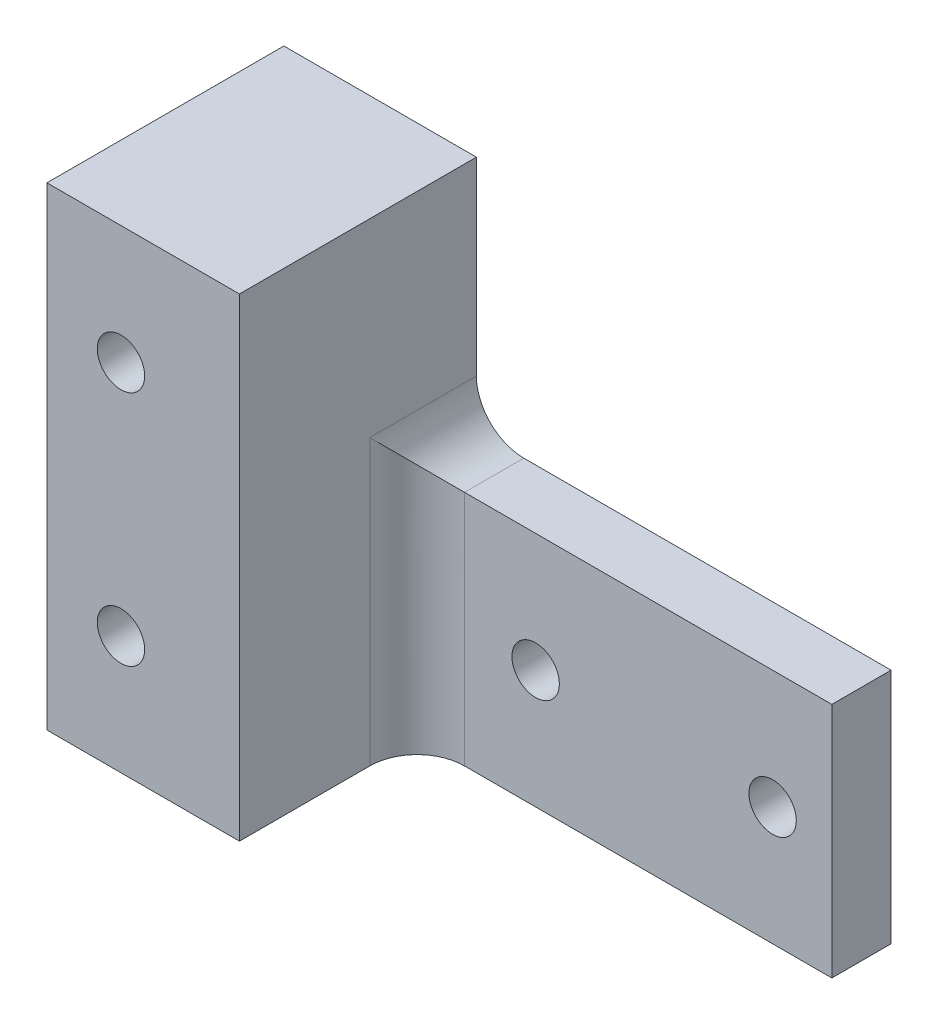
from build123d import *

# Parameters (mm, degrees)
BOSS_EXTRUDE1_DEPTH = 25.4
SKETCH2_R           = 2.54
CUT_EXTRUDE1_DEPTH  = 91.02678768
SKETCH3_W           = 4.7625
SKETCH3_H           = 50.8
CUT_EXTRUDE2_DEPTH  = 91.02678768
SKETCH4_W           = 44.45
SKETCH4_H           = 19.05
CUT_EXTRUDE3_DEPTH  = 91.02678768
FILLET1_R           = 5.08
SKETCH6_R           = 4.445
CUT_EXTRUDE5_DEPTH  = 12.7


with BuildPart() as part:
    # Sketch1 → Boss-Extrude1 (new body)
    with BuildSketch(Plane.XY):
        Polygon((0, 0), (0, 50.8), (25.4, 50.8), (25.4, 25.4), (69.85, 25.4), (69.85, 0), align=None)
    extrude(amount=BOSS_EXTRUDE1_DEPTH)

    # Sketch2 → Cut-Extrude1 (cut, through all)
    with BuildSketch(Plane.XY.offset(25.4)):
        with Locations((12.7, 38.1)):
            Circle(SKETCH2_R)
        with Locations((12.7, 12.7)):
            Circle(SKETCH2_R)
        with Locations((38.1, 12.7)):
            Circle(SKETCH2_R)
        with Locations((63.5, 12.7)):
            Circle(SKETCH2_R)
    extrude(amount=-CUT_EXTRUDE1_DEPTH, mode=Mode.SUBTRACT)

    # Sketch3 → Cut-Extrude2 (cut, through all)
    with BuildSketch(Plane.XY.offset(25.4)):
        with Locations((2.38125, 25.4)):
            Rectangle(SKETCH3_W, SKETCH3_H)
    extrude(amount=-CUT_EXTRUDE2_DEPTH, mode=Mode.SUBTRACT)

    # Sketch4 → Cut-Extrude3 (cut, through all)
    with BuildSketch(Plane.XZ):
        with Locations((47.625, 15.875)):
            Rectangle(SKETCH4_W, SKETCH4_H)
    extrude(amount=-CUT_EXTRUDE3_DEPTH, mode=Mode.SUBTRACT)

    # Fillet1
    fillet1_edges = [part.edges().sort_by_distance(p)[0] for p in [
        (25.4, 25.4, 3.175),
        (25.4, 12.7, 6.35),
    ]]
    fillet(fillet1_edges, radius=FILLET1_R)

    # Sketch6 → Cut-Extrude5 (cut)
    with BuildSketch(Plane(origin=(0, 0, 0), x_dir=(-1, 0, 0), z_dir=(0, 0, -1))):
        with Locations((-12.7, 38.1)):
            Circle(SKETCH6_R)
    extrude(amount=-CUT_EXTRUDE5_DEPTH, mode=Mode.SUBTRACT)


solid = part.part
